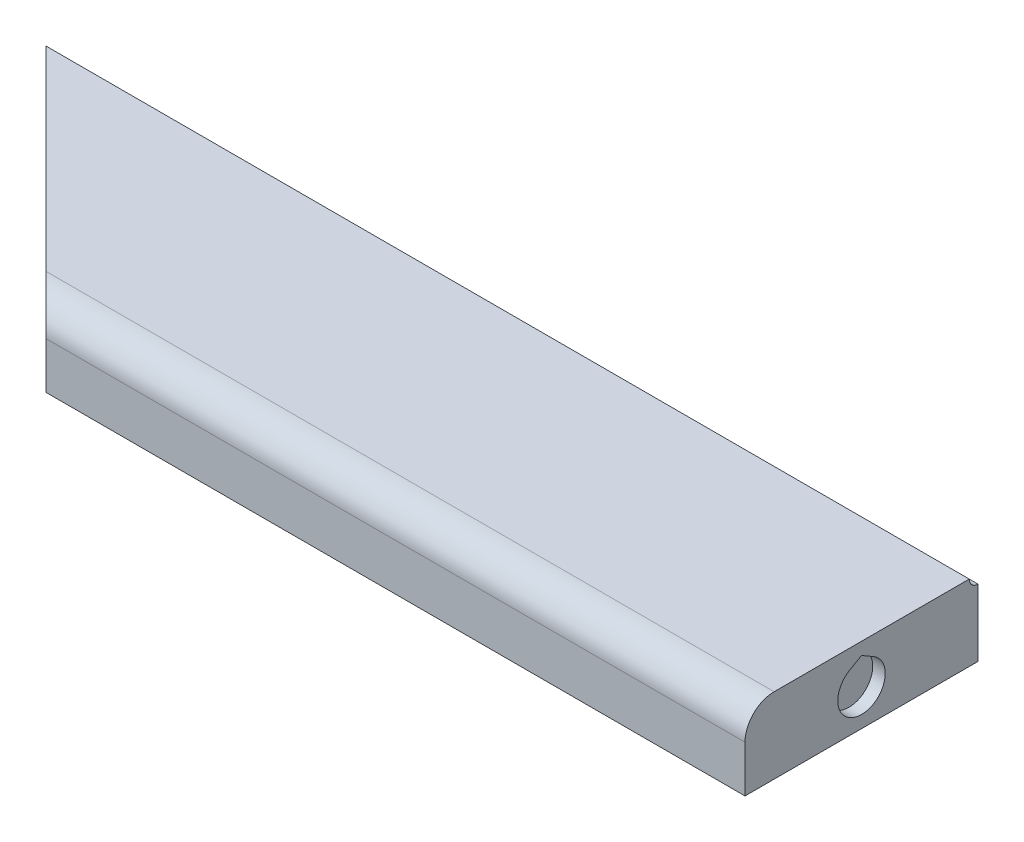
from build123d import *

# Parameters (mm, degrees)
EXTRUDE_1_DEPTH     = 13
SWEEP_START         = -80
SWEEP_1_DEPTH       = 160
SKETCH_6_R          = 4.075
CUT_EXTRUDE_1_DEPTH = 2.15
FILLET_1_R          = 5
SKETCH_7_R          = 4.075
CUT_EXTRUDE_2_DEPTH = 2.15


# Read off the part's stored shape, not the designer's step: Вырез-По траектории1
with BuildPart() as part:
    # Эскиз1 → Бобышка-Вытянуть1 (new body)
    with BuildSketch(Plane(origin=(0, 0, 0), x_dir=(1, 0, 0), z_dir=(0, 1, 0))):
        Polygon((-40, -20), (80, -20), (80, 20), (-80, 20), align=None)
    extrude(amount=-EXTRUDE_1_DEPTH)

    # Вырез-По траектории1 outline → Вырез-По траектории1 (cut)
    with BuildSketch(Plane.YZ.offset(SWEEP_START)):
        with BuildLine():
            ThreePointArc((0, -18.5), (-1.060660172, -18.939339828), (-1.5, -20))
            Line((-1.5, -20), (0, -20))
            Line((0, -20), (0, -18.5))
        make_face()
    extrude(amount=SWEEP_1_DEPTH, mode=Mode.SUBTRACT)

    # Эскиз6 → Вырез-Вытянуть1 (cut)
    with BuildSketch(Plane(origin=(0, 0, -20), x_dir=(-1, 0, 0), z_dir=(0, 0, -1))):
        with Locations((-40, -7.565202347)):
            Circle(SKETCH_6_R)
        with BuildLine():
            Line((-40, -2.859797653), (-42.0375, -4.036148827))
            ThreePointArc((-42.0375, -4.036148827), (-40, -3.490202347), (-37.9625, -4.036148827))
            Line((-37.9625, -4.036148827), (-40, -2.859797653))
        make_face()
        with Locations((40, -7.565202347)):
            Circle(SKETCH_6_R)
        with BuildLine():
            ThreePointArc((37.9625, -4.036148827), (40, -3.490202347), (42.0375, -4.036148827))
            Line((42.0375, -4.036148827), (40, -2.859797653))
            Line((40, -2.859797653), (37.9625, -4.036148827))
        make_face()
    extrude(amount=-CUT_EXTRUDE_1_DEPTH, mode=Mode.SUBTRACT)

    # Скругление1
    fillet_1_edges = [part.edges().sort_by_distance(p)[0] for p in [
        (20, 0, 20),
    ]]
    fillet(fillet_1_edges, radius=FILLET_1_R)

    # Эскиз7 → Вырез-Вытянуть2 (cut)
    with BuildSketch(Plane.ZY.offset(-80)):
        with Locations((0, -6.815202347)):
            Circle(SKETCH_7_R)
        with BuildLine():
            Line((2.0375, -3.286148827), (0, -2.109797653))
            Line((0, -2.109797653), (-2.0375, -3.286148827))
            ThreePointArc((-2.0375, -3.286148827), (0, -2.740202347), (2.0375, -3.286148827))
        make_face()
    extrude(amount=CUT_EXTRUDE_2_DEPTH, mode=Mode.SUBTRACT)


solid = part.part
